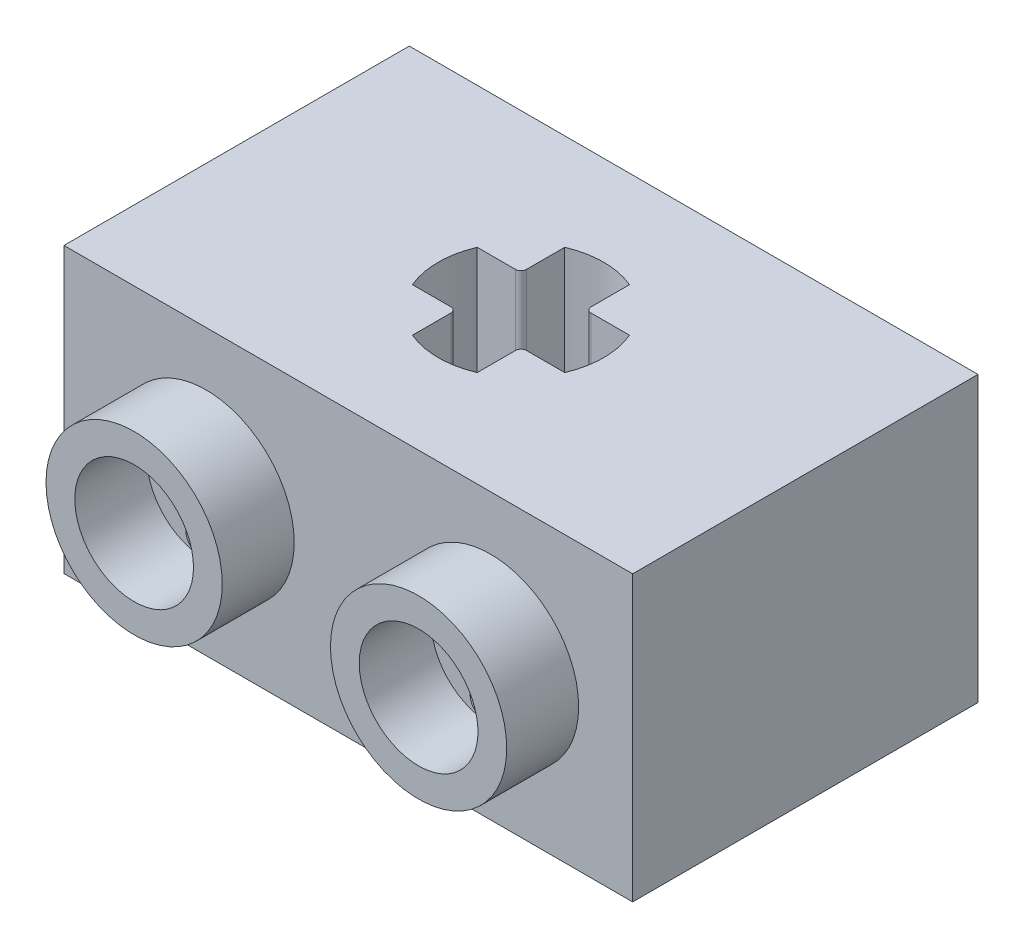
from build123d import *

# Parameters (mm, degrees)
SKETCH2_W                = 15.81
SKETCH2_H                = 7.9
BOSS_EXTRUDE3_DEPTH      = 9.6
SKETCH3_W                = 12.91
SKETCH3_H                = 5
CUT_EXTRUDE1_DEPTH       = 8.6
SKETCH5_R                = 2.535
BOSS_EXTRUDE4_DEPTH      = 7.9
CUT_EXTRUDE2_DEPTH       = 15.732923165
CUT_EXTRUDE2_DEPTH_BACK  = 15.732923165
BOSS_EXTRUDE5_REACH      = 15.048
BOSS_EXTRUDE5_END_RADIUS = 2.535
SKETCH9_R                = 2.449999362
SKETCH9_R_2              = 1.649999362
BOSS_EXTRUDE6_DEPTH      = 2
WRAP1_DEPTH              = 0.05


# Read off the part's stored shape, not the designer's step: Wrap1
with BuildPart() as part:
    # Sketch2 → Boss-Extrude3 (new body)
    with BuildSketch(Plane.XY):
        Rectangle(SKETCH2_W, SKETCH2_H)
    extrude(amount=BOSS_EXTRUDE3_DEPTH)

    # Sketch3 → Cut-Extrude1 (cut)
    with BuildSketch(Plane(origin=(0, 0, 0), x_dir=(-1, 0, 0), z_dir=(0, 0, -1))):
        Rectangle(SKETCH3_W, SKETCH3_H)
    extrude(amount=-CUT_EXTRUDE1_DEPTH, mode=Mode.SUBTRACT)

    # Sketch5 → Boss-Extrude4 (add)
    with BuildSketch(Plane.XZ.offset(3.95)):
        with Locations(Location((0, 4.8, 0), (0, 0, 270))):
            Circle(SKETCH5_R)
        with BuildLine():
            Line((-0.9, 6.916601049), (-0.9, 5.85))
            ThreePointArc((-0.9, 5.85), (-0.943933983, 5.743933983), (-1.05, 5.7))
            Line((-1.05, 5.7), (-2.116601049, 5.7))
            ThreePointArc((-2.116601049, 5.7), (-2.3, 4.8), (-2.116601049, 3.9))
            Line((-2.116601049, 3.9), (-1.05, 3.9))
            ThreePointArc((-1.05, 3.9), (-0.943933983, 3.856066017), (-0.9, 3.75))
            Line((-0.9, 3.75), (-0.9, 2.683398951))
            ThreePointArc((-0.9, 2.683398951), (0, 2.5), (0.9, 2.683398951))
            Line((0.9, 2.683398951), (0.9, 3.75))
            ThreePointArc((0.9, 3.75), (0.943933983, 3.856066017), (1.05, 3.9))
            Line((1.05, 3.9), (2.116601049, 3.9))
            ThreePointArc((2.116601049, 3.9), (2.3, 4.8), (2.116601049, 5.7))
            Line((2.116601049, 5.7), (1.05, 5.7))
            ThreePointArc((1.05, 5.7), (0.943933983, 5.743933983), (0.9, 5.85))
            Line((0.9, 5.85), (0.9, 6.916601049))
            ThreePointArc((0.9, 6.916601049), (0, 7.1), (-0.9, 6.916601049))
        make_face(mode=Mode.SUBTRACT)
    extrude(amount=-BOSS_EXTRUDE4_DEPTH)

    # Sketch5<3> → Cut-Extrude2 (cut, two sides: drawn at the far end of the back side and taken through both)
    with BuildSketch(Plane.XZ.offset(3.95).offset(-CUT_EXTRUDE2_DEPTH_BACK)):
        with BuildLine():
            ThreePointArc((0.9, 6.916601049), (0, 7.1), (-0.9, 6.916601049))
            Line((-0.9, 6.916601049), (-0.9, 5.85))
            ThreePointArc((-0.9, 5.85), (-0.943933983, 5.743933983), (-1.05, 5.7))
            Line((-1.05, 5.7), (-2.116601049, 5.7))
            ThreePointArc((-2.116601049, 5.7), (-2.3, 4.8), (-2.116601049, 3.9))
            Line((-2.116601049, 3.9), (-1.05, 3.9))
            ThreePointArc((-1.05, 3.9), (-0.943933983, 3.856066017), (-0.9, 3.75))
            Line((-0.9, 3.75), (-0.9, 2.683398951))
            ThreePointArc((-0.9, 2.683398951), (0, 2.5), (0.9, 2.683398951))
            Line((0.9, 2.683398951), (0.9, 3.75))
            ThreePointArc((0.9, 3.75), (0.943933983, 3.856066017), (1.05, 3.9))
            Line((1.05, 3.9), (2.116601049, 3.9))
            ThreePointArc((2.116601049, 3.9), (2.3, 4.8), (2.116601049, 5.7))
            Line((2.116601049, 5.7), (1.05, 5.7))
            ThreePointArc((1.05, 5.7), (0.943933983, 5.743933983), (0.9, 5.85))
            Line((0.9, 5.85), (0.9, 6.916601049))
        make_face()
    extrude(amount=CUT_EXTRUDE2_DEPTH + CUT_EXTRUDE2_DEPTH_BACK, mode=Mode.SUBTRACT)

    # Boss-Extrude5: up to this cylinder (the profile starts outside it)
    boss_extrude5_end = Plane(origin=(0, 0, 4.8), z_dir=(0, -1, 0)) * Cylinder(BOSS_EXTRUDE5_END_RADIUS, 40.222098, mode=Mode.PRIVATE)
    # Sketch8 → Boss-Extrude5 (add, up to the surface)
    with BuildSketch(Plane.XY, mode=Mode.PRIVATE) as boss_extrude5_sk1:
        with BuildLine():
            Line((1.142937221, 2.5), (1.142937221, 1.55))
            ThreePointArc((1.142937221, 1.55), (1.647670427, 1.525203497), (2.022937221, 1.863648927))
            Line((2.022937221, 1.863648927), (2.022937221, 2.5))
            Line((2.022937221, 2.5), (1.142937221, 2.5))
        make_face()
    boss_extrude5_tool1 = extrude(boss_extrude5_sk1.sketch, amount=BOSS_EXTRUDE5_REACH, mode=Mode.PRIVATE) - boss_extrude5_end
    add(boss_extrude5_tool1.solids().sort_by_distance((1.562277, 2.028049, 0))[0])
    # Sketch8 → Boss-Extrude5 (add, up to the surface)
    with BuildSketch(Plane.XY, mode=Mode.PRIVATE) as boss_extrude5_sk2:
        with BuildLine():
            Line((-2.022937221, 2.5), (-1.142937221, 2.5))
            Line((-1.142937221, 2.5), (-1.142937221, 1.55))
            ThreePointArc((-1.142937221, 1.55), (-1.647670427, 1.525203497), (-2.022937221, 1.863648927))
            Line((-2.022937221, 1.863648927), (-2.022937221, 2.5))
        make_face()
    boss_extrude5_tool2 = extrude(boss_extrude5_sk2.sketch, amount=BOSS_EXTRUDE5_REACH, mode=Mode.PRIVATE) - boss_extrude5_end
    add(boss_extrude5_tool2.solids().sort_by_distance((-1.562277, 2.028049, 0))[0])
    # Sketch8 → Boss-Extrude5 (add, up to the surface)
    with BuildSketch(Plane.XY, mode=Mode.PRIVATE) as boss_extrude5_sk3:
        with BuildLine():
            Line((-1.142937221, -2.5), (-1.142937221, -1.55))
            ThreePointArc((-1.142937221, -1.55), (-1.647670427, -1.525203497), (-2.022937221, -1.863648927))
            Line((-2.022937221, -1.863648927), (-2.022937221, -2.5))
            Line((-2.022937221, -2.5), (-1.142937221, -2.5))
        make_face()
    boss_extrude5_tool3 = extrude(boss_extrude5_sk3.sketch, amount=BOSS_EXTRUDE5_REACH, mode=Mode.PRIVATE) - boss_extrude5_end
    add(boss_extrude5_tool3.solids().sort_by_distance((-1.562277, -2.028049, 0))[0])
    # Sketch8 → Boss-Extrude5 (add, up to the surface)
    with BuildSketch(Plane.XY, mode=Mode.PRIVATE) as boss_extrude5_sk4:
        with BuildLine():
            Line((2.022937221, -2.5), (1.142937221, -2.5))
            Line((1.142937221, -2.5), (1.142937221, -1.55))
            ThreePointArc((1.142937221, -1.55), (1.647670427, -1.525203497), (2.022937221, -1.863648927))
            Line((2.022937221, -1.863648927), (2.022937221, -2.5))
        make_face()
    boss_extrude5_tool4 = extrude(boss_extrude5_sk4.sketch, amount=BOSS_EXTRUDE5_REACH, mode=Mode.PRIVATE) - boss_extrude5_end
    add(boss_extrude5_tool4.solids().sort_by_distance((1.562277, -2.028049, 0))[0])

    # Sketch9 → Boss-Extrude6 (add)
    # profile 1 of 2: a face of its own
    with BuildSketch(Plane.XY.offset(9.6)):
        with Locations(Location((-3.953750395, -0.001249605, 0), (0, 0, 180))):
            Circle(SKETCH9_R)
        with Locations((-3.953750395, -0.001249605)):
            Circle(SKETCH9_R_2, mode=Mode.SUBTRACT)
    # profile 2 of 2: a face of its own
    with BuildSketch(Plane.XY.offset(9.6)):
        with Locations(Location((3.953750395, -0.001249605, 0), (0, 0, 180))):
            Circle(SKETCH9_R)
        with Locations(Location((3.953750395, -0.001249605, 0), (0, 0, 180))):
            Circle(SKETCH9_R_2, mode=Mode.SUBTRACT)
    extrude(amount=BOSS_EXTRUDE6_DEPTH)

    # Wrap1 outline → Wrap1 (add)
    # profile 1 of 8: a face of its own
    with BuildSketch(Plane.XY.offset(9.6)):
        with BuildLine():
            add(Edge.make_bspline(
                [(3.539944984, -0.602676098), (3.532678796, -0.591193563), (3.517960093, -0.567934046), (3.498769062, -0.530618207), (3.481506482, -0.491077195), (3.466454355, -0.44962691), (3.454216198, -0.407208885), (3.445353936, -0.364589366), (3.439810331, -0.322331597), (3.439060411, -0.294213301), (3.438688974, -0.280286274)],
                knots=[0, 0, 0, 0, 0.119014041, 0.241079968, 0.367207712, 0.496859168, 0.627198146, 0.753675035, 0.877994942, 1, 1, 1, 1], degree=3))
            Line((3.539944984, -0.602676098), (3.874971026, -0.671343967))
            Line((3.874971026, -0.671343967), (3.874971026, -0.312541883))
            Line((3.874971026, -0.312541883), (3.779201795, -0.292257428))
            Line((3.779201795, -0.292257428), (3.779201795, -0.554292685))
            Line((3.779201795, -0.554292685), (3.604456202, -0.518545489))
            add(Edge.make_bspline(
                [(3.534458205, -0.277459752), (3.534715676, -0.286889065), (3.535236513, -0.305963615), (3.538469638, -0.334874887), (3.543989038, -0.364252278), (3.551749954, -0.394157355), (3.561506404, -0.424631227), (3.573865632, -0.455530706), (3.587792762, -0.487207488), (3.598833403, -0.507971004), (3.604456202, -0.518545489)],
                knots=[0, 0, 0, 0, 0.111547485, 0.225649323, 0.343691201, 0.464857784, 0.590915004, 0.721913245, 0.85837542, 1, 1, 1, 1], degree=3))
            add(Edge.make_bspline(
                [(3.782028317, -0.037039079), (3.772155195, -0.037220656), (3.752915608, -0.037574491), (3.725002549, -0.040597129), (3.698942449, -0.045492843), (3.674792036, -0.052544663), (3.652387419, -0.06139018), (3.632013715, -0.072684474), (3.613364315, -0.085682867), (3.596661536, -0.100703809), (3.582077699, -0.117563627), (3.569276584, -0.135876603), (3.558456486, -0.155724365), (3.549634668, -0.177136865), (3.542777876, -0.200086344), (3.538110294, -0.224548839), (3.534969436, -0.250499168), (3.534631793, -0.268305311), (3.534458205, -0.277459752)],
                knots=[0, 0, 0, 0, 0.07531528, 0.146765628, 0.21394358, 0.277375486, 0.338469483, 0.397328763, 0.454698705, 0.511591307, 0.568239783, 0.624431844, 0.681772167, 0.74035737, 0.800830599, 0.864191986, 0.930178786, 1, 1, 1, 1], degree=3))
            add(Edge.make_bspline(
                [(4.194201795, -0.387195329), (4.194107527, -0.379539752), (4.193919906, -0.364302864), (4.191376979, -0.341666268), (4.187882017, -0.319290714), (4.182417789, -0.297404219), (4.175901106, -0.275820356), (4.167358629, -0.25483745), (4.157866674, -0.233993501), (4.146501135, -0.213752245), (4.133742829, -0.194189534), (4.119586918, -0.175410681), (4.103710632, -0.157810433), (4.08636545, -0.14108628), (4.067423643, -0.125523371), (4.046941419, -0.110978431), (4.025058417, -0.097334592), (4.001614015, -0.084961905), (3.977157486, -0.073695106), (3.951746029, -0.063804688), (3.925461715, -0.055542138), (3.898386602, -0.048671358), (3.870424586, -0.043609368), (3.84175497, -0.039703454), (3.812154015, -0.037592688), (3.792173506, -0.037225513), (3.782028317, -0.037039079)],
                knots=[0, 0, 0, 0, 0.037928531, 0.075489126, 0.112795671, 0.150110308, 0.187215005, 0.224456754, 0.262314575, 0.300686267, 0.339395775, 0.378023303, 0.417128548, 0.456765771, 0.497358788, 0.538525081, 0.581216949, 0.62509282, 0.669839089, 0.714633405, 0.760162233, 0.806337966, 0.853001484, 0.900947803, 0.949705823, 1, 1, 1, 1], degree=3))
            add(Edge.make_bspline(
                [(4.023945385, -0.608329143), (4.030618543, -0.606697317), (4.043761715, -0.603483341), (4.062691931, -0.597284856), (4.080237629, -0.589421733), (4.096812145, -0.580947807), (4.112042292, -0.570793559), (4.12612199, -0.559614957), (4.138920788, -0.547081406), (4.150583653, -0.533509099), (4.160805425, -0.518670364), (4.169959562, -0.502968437), (4.177360909, -0.486074641), (4.183540469, -0.468227856), (4.188335868, -0.449369131), (4.191850569, -0.429537723), (4.193828173, -0.408684315), (4.194075492, -0.394459689), (4.194201795, -0.387195329)],
                knots=[0, 0, 0, 0, 0.06746451, 0.132875274, 0.19527459, 0.256145175, 0.315477603, 0.374730075, 0.432470568, 0.491157773, 0.550199845, 0.609209289, 0.669396999, 0.73102467, 0.794527735, 0.860304392, 0.928658985, 1, 1, 1, 1], degree=3))
            Line((4.023945385, -0.608329143), (4.03458641, -0.704098374))
            add(Edge.make_bspline(
                [(4.289971026, -0.389523053), (4.289611674, -0.403624023), (4.288907965, -0.431237634), (4.28269093, -0.471508212), (4.273054413, -0.509736243), (4.261250732, -0.539670885), (4.250206832, -0.562168582), (4.241077279, -0.577817821), (4.231769394, -0.592730177), (4.221283247, -0.606353797), (4.210440788, -0.619209944), (4.198640382, -0.630857693), (4.186436957, -0.641734476), (4.168733001, -0.654759925), (4.144297797, -0.669362983), (4.111343073, -0.683720474), (4.074493723, -0.695778258), (4.04823062, -0.701253747), (4.03458641, -0.704098374)],
                knots=[0, 0, 0, 0, 0.094575967, 0.185205985, 0.2727996, 0.358651345, 0.400567544, 0.440887387, 0.480196164, 0.51843101, 0.556150437, 0.592969775, 0.629602666, 0.665754712, 0.74032025, 0.820077659, 0.906526729, 1, 1, 1, 1], degree=3))
            add(Edge.make_bspline(
                [(3.782360849, 0.058730152), (3.794558856, 0.058534679), (3.818770133, 0.058146695), (3.85465606, 0.055163088), (3.8897029, 0.049873494), (3.923967339, 0.043059701), (3.957306146, 0.033795023), (3.989882574, 0.02267408), (4.021541829, 0.009335078), (4.05226486, -0.005729785), (4.08145812, -0.022445727), (4.108962432, -0.040226481), (4.134515791, -0.059026709), (4.158047339, -0.078999792), (4.179452593, -0.100151735), (4.199084273, -0.122153698), (4.216606971, -0.145336012), (4.232025328, -0.169660514), (4.245616697, -0.194747745), (4.257561277, -0.220475444), (4.267450714, -0.246977358), (4.275880476, -0.274076212), (4.282184026, -0.301996701), (4.286556001, -0.330559803), (4.289604261, -0.359806704), (4.289847802, -0.379539137), (4.289971026, -0.389523053)],
                knots=[0, 0, 0, 0, 0.048371301, 0.096010026, 0.142665654, 0.188873398, 0.234462818, 0.279780701, 0.325293766, 0.370607385, 0.415397749, 0.458620577, 0.500425354, 0.541119353, 0.580906413, 0.619674518, 0.657961784, 0.696007938, 0.733773729, 0.771045104, 0.80839675, 0.845869768, 0.883512564, 0.921779007, 0.960422932, 1, 1, 1, 1], degree=3))
            add(Edge.make_bspline(
                [(3.547094423, -0.015091964), (3.55484345, -0.009150109), (3.570407384, 0.002784115), (3.596073642, 0.017526957), (3.62303964, 0.030552329), (3.651864961, 0.040726777), (3.682124505, 0.048987547), (3.714144295, 0.054485296), (3.747693931, 0.058108219), (3.770656867, 0.058520179), (3.782360849, 0.058730152)],
                knots=[0, 0, 0, 0, 0.116378168, 0.23374574, 0.352343528, 0.473232311, 0.597855211, 0.726129114, 0.860410701, 1, 1, 1, 1], degree=3))
            add(Edge.make_bspline(
                [(3.438688974, -0.280286274), (3.438968405, -0.265914612), (3.439509794, -0.23806995), (3.444816062, -0.19771842), (3.453180395, -0.160153418), (3.464946336, -0.125285633), (3.480319615, -0.093290715), (3.499092315, -0.064163142), (3.52107458, -0.037602205), (3.538389394, -0.022622843), (3.547094423, -0.015091964)],
                knots=[0, 0, 0, 0, 0.145278943, 0.281473568, 0.41078632, 0.533976328, 0.652804696, 0.768789948, 0.88375906, 1, 1, 1, 1], degree=3))
        make_face()
    # profile 2 of 8: a face of its own
    with BuildSketch(Plane.XY.offset(9.6)):
        with BuildLine():
            add(Edge.make_bspline(
                [(4.289971026, -1.267241403), (4.289726718, -1.279673594), (4.289247064, -1.304081865), (4.284204253, -1.339744602), (4.276515642, -1.3736969), (4.265462911, -1.405857415), (4.251261564, -1.436200281), (4.234099548, -1.464918793), (4.213399196, -1.491541666), (4.19009978, -1.516468807), (4.164018466, -1.538895503), (4.13554192, -1.558425144), (4.105062745, -1.575139706), (4.072322191, -1.588669753), (4.03749017, -1.599091277), (4.000537636, -1.606530432), (3.961489108, -1.61110497), (3.934728746, -1.611637966), (3.921026715, -1.611910874)],
                knots=[0, 0, 0, 0, 0.065561895, 0.128718463, 0.189656453, 0.249031943, 0.307776767, 0.366157209, 0.425178009, 0.485383876, 0.545938906, 0.606292333, 0.667280128, 0.729032333, 0.792871126, 0.858829055, 0.927716649, 1, 1, 1, 1], degree=3))
            add(Edge.make_bspline(
                [(3.797491058, -0.835116002), (3.815407557, -0.835500423), (3.850451546, -0.836252335), (3.90176293, -0.842098623), (3.950432675, -0.852071204), (3.996527546, -0.865877737), (4.040078511, -0.883464176), (4.080782039, -0.905414848), (4.118973741, -0.931158124), (4.154138767, -0.960627298), (4.18583617, -0.992836437), (4.213729514, -1.026943117), (4.237316435, -1.062796375), (4.256530681, -1.100457134), (4.271634986, -1.139723541), (4.282275983, -1.180767205), (4.288720655, -1.223474999), (4.289550797, -1.252532228), (4.289971026, -1.267241403)],
                knots=[0, 0, 0, 0, 0.073386139, 0.143540482, 0.211222755, 0.276659402, 0.340408537, 0.403286895, 0.465755232, 0.528779351, 0.590912165, 0.650626303, 0.70900205, 0.766373054, 0.823507709, 0.881000335, 0.939760712, 1, 1, 1, 1], degree=3))
            add(Edge.make_bspline(
                [(3.438688974, -1.176958951), (3.43878188, -1.168860588), (3.438965551, -1.152850516), (3.441484656, -1.12915502), (3.445058, -1.105982871), (3.450195158, -1.083358722), (3.456948566, -1.061356848), (3.464837096, -1.03977085), (3.474629026, -1.018882633), (3.48542048, -0.998406546), (3.497973198, -0.979096579), (3.51140438, -0.96062921), (3.526229831, -0.943591614), (3.542098261, -0.927610966), (3.559277978, -0.913081768), (3.577418885, -0.899438354), (3.596941559, -0.887405664), (3.617391953, -0.876452954), (3.638556265, -0.866615512), (3.660361364, -0.858426197), (3.682374647, -0.851230902), (3.704695753, -0.845130087), (3.727441719, -0.840722468), (3.750537491, -0.837587142), (3.773898213, -0.835490282), (3.789616676, -0.835240922), (3.797491058, -0.835116002)],
                knots=[0, 0, 0, 0, 0.043743457, 0.086478703, 0.128627456, 0.170404265, 0.211713602, 0.25293708, 0.29448027, 0.336287127, 0.377910132, 0.418823457, 0.459592923, 0.49983088, 0.540405162, 0.581077705, 0.622380528, 0.664187385, 0.706399937, 0.748395181, 0.789973984, 0.831530128, 0.873350929, 0.915071874, 0.957454082, 1, 1, 1, 1], degree=3))
            add(Edge.make_bspline(
                [(3.479091619, -1.354032268), (3.475834527, -1.34709073), (3.46932742, -1.333222734), (3.46135706, -1.311752317), (3.454236453, -1.290110678), (3.448654566, -1.268090524), (3.444096417, -1.245800577), (3.440957979, -1.2231434), (3.439110344, -1.2001564), (3.438829974, -1.184721352), (3.438688974, -1.176958951)],
                knots=[0, 0, 0, 0, 0.125524858, 0.250777039, 0.374779807, 0.498503214, 0.622575723, 0.747217984, 0.872874041, 1, 1, 1, 1], degree=3))
            add(Edge.make_bspline(
                [(3.698063974, -1.56352746), (3.685591085, -1.557306525), (3.660989184, -1.545036166), (3.626420994, -1.523205233), (3.594474664, -1.499087666), (3.56516699, -1.472874971), (3.539031489, -1.444745704), (3.515692341, -1.415706357), (3.495379053, -1.385657886), (3.484488592, -1.364511673), (3.479091619, -1.354032268)],
                knots=[0, 0, 0, 0, 0.135343291, 0.266955161, 0.396502281, 0.523849941, 0.648418396, 0.769085728, 0.885566078, 1, 1, 1, 1], degree=3))
            add(Edge.make_bspline(
                [(3.921026715, -1.611910874), (3.911103174, -1.611721648), (3.891399641, -1.611345932), (3.862132343, -1.609240142), (3.833395773, -1.60533466), (3.805191474, -1.600061103), (3.777539178, -1.593250413), (3.750482821, -1.584837353), (3.723884503, -1.575167397), (3.706664834, -1.567404742), (3.698063974, -1.56352746)],
                knots=[0, 0, 0, 0, 0.129450941, 0.257029292, 0.382476162, 0.507528738, 0.63113749, 0.753699654, 0.876978195, 1, 1, 1, 1], degree=3))
        make_face()
        with BuildLine():
            add(Edge.make_bspline(
                [(3.534458205, -1.184274656), (3.534783323, -1.195109427), (3.535429743, -1.216651829), (3.541458793, -1.248465506), (3.550485975, -1.279606646), (3.563571359, -1.309664492), (3.579961923, -1.338409318), (3.599145335, -1.365868872), (3.621435851, -1.391631545), (3.646320782, -1.416089929), (3.674511294, -1.438160443), (3.705711676, -1.457903356), (3.739908704, -1.475179707), (3.776662582, -1.489753113), (3.814700827, -1.501446141), (3.853035484, -1.509716489), (3.890994916, -1.515213864), (3.916297437, -1.51583414), (3.928841218, -1.516141643)],
                knots=[0, 0, 0, 0, 0.056929802, 0.113191558, 0.169728243, 0.227177277, 0.28513283, 0.343517798, 0.403050568, 0.464064854, 0.526750923, 0.590956916, 0.657960909, 0.727947498, 0.798667741, 0.866990194, 0.934060092, 1, 1, 1, 1], degree=3))
            add(Edge.make_bspline(
                [(3.793168141, -0.930885233), (3.781447609, -0.931260399), (3.7584123, -0.931997744), (3.7246042, -0.938091565), (3.692208004, -0.947608393), (3.666575995, -0.959091503), (3.647190252, -0.970033231), (3.633427431, -0.979289152), (3.620438661, -0.989409701), (3.608262381, -1.000586458), (3.596983055, -1.012754861), (3.586432343, -1.025772745), (3.576768195, -1.039786101), (3.565210425, -1.059593718), (3.552762723, -1.085345505), (3.54235916, -1.117637485), (3.535711303, -1.150694688), (3.534877137, -1.173048308), (3.534458205, -1.184274656)],
                knots=[0, 0, 0, 0, 0.086719102, 0.170436061, 0.25352114, 0.336179565, 0.377709943, 0.418224504, 0.458855261, 0.499512943, 0.540449198, 0.581590586, 0.623476208, 0.666333386, 0.751311899, 0.834617569, 0.916942284, 1, 1, 1, 1], degree=3))
            add(Edge.make_bspline(
                [(4.194201795, -1.269070329), (4.193905221, -1.258075289), (4.193317707, -1.236294064), (4.187918785, -1.204193677), (4.179457996, -1.173008777), (4.167425841, -1.142849638), (4.151917924, -1.113730048), (4.13329264, -1.085497412), (4.110875956, -1.058493148), (4.085555137, -1.032571397), (4.05730306, -1.008723825), (4.026479616, -0.98774871), (3.993300117, -0.970101995), (3.957702748, -0.955787271), (3.919880489, -0.944429805), (3.879676336, -0.936543857), (3.837173607, -0.93186177), (3.808088778, -0.931216341), (3.793168141, -0.930885233)],
                knots=[0, 0, 0, 0, 0.056367129, 0.111663549, 0.16649901, 0.221883074, 0.277844317, 0.335488418, 0.395082478, 0.457610277, 0.521171557, 0.584416641, 0.648522467, 0.713569037, 0.7809433, 0.850810297, 0.923465067, 1, 1, 1, 1], degree=3))
            add(Edge.make_bspline(
                [(3.928841218, -1.516141643), (3.938716859, -1.515921232), (3.957971895, -1.515491487), (3.986107295, -1.512050092), (4.012755291, -1.506710478), (4.037806303, -1.498843046), (4.061337112, -1.488804895), (4.083314075, -1.476504279), (4.103736328, -1.461908728), (4.122451095, -1.445350384), (4.139212898, -1.427073919), (4.153814457, -1.407579308), (4.166541106, -1.387167418), (4.176601282, -1.365518626), (4.184494104, -1.342842619), (4.190145189, -1.319177994), (4.193514464, -1.294439755), (4.193970275, -1.277615751), (4.194201795, -1.269070329)],
                knots=[0, 0, 0, 0, 0.072790231, 0.141922799, 0.20867778, 0.272908844, 0.335147688, 0.396982817, 0.458211472, 0.519869482, 0.580890536, 0.640712271, 0.699230311, 0.757907918, 0.816318862, 0.875982692, 0.937007849, 1, 1, 1, 1], degree=3))
        make_face(mode=Mode.SUBTRACT)
    # profile 3 of 8: a face of its own
    with BuildSketch(Plane.XY.offset(9.6)):
        with BuildLine():
            add(Edge.make_bspline(
                [(-4.365055016, -0.601875336), (-4.372321204, -0.590392801), (-4.387039907, -0.567133284), (-4.406230938, -0.529817444), (-4.423493518, -0.490276433), (-4.438545645, -0.448826148), (-4.450783802, -0.406408123), (-4.459646064, -0.363788603), (-4.465189669, -0.321530835), (-4.465939589, -0.293412538), (-4.466311026, -0.279485512)],
                knots=[0, 0, 0, 0, 0.119014041, 0.241079968, 0.367207712, 0.496859168, 0.627198146, 0.753675035, 0.877994942, 1, 1, 1, 1], degree=3))
            Line((-4.365055016, -0.601875336), (-4.030028974, -0.670543204))
            Line((-4.030028974, -0.670543204), (-4.030028974, -0.311741121))
            Line((-4.030028974, -0.311741121), (-4.125798205, -0.291456666))
            Line((-4.125798205, -0.291456666), (-4.125798205, -0.553491922))
            Line((-4.125798205, -0.553491922), (-4.300543798, -0.517744727))
            add(Edge.make_bspline(
                [(-4.370541795, -0.276658989), (-4.370284324, -0.286088302), (-4.369763487, -0.305162852), (-4.366530362, -0.334074124), (-4.361010962, -0.363451516), (-4.353250046, -0.393356593), (-4.343493596, -0.423830465), (-4.331134368, -0.454729944), (-4.317207238, -0.486406726), (-4.306166597, -0.507170242), (-4.300543798, -0.517744727)],
                knots=[0, 0, 0, 0, 0.111547485, 0.225649323, 0.343691201, 0.464857784, 0.590915004, 0.721913245, 0.85837542, 1, 1, 1, 1], degree=3))
            add(Edge.make_bspline(
                [(-4.122971683, -0.036238316), (-4.132844805, -0.036419893), (-4.152084392, -0.036773728), (-4.179997451, -0.039796366), (-4.206057551, -0.04469208), (-4.230207964, -0.0517439), (-4.252612581, -0.060589418), (-4.272986285, -0.071883712), (-4.291635685, -0.084882104), (-4.308338464, -0.099903046), (-4.322922301, -0.116762864), (-4.335723416, -0.13507584), (-4.346543514, -0.154923603), (-4.355365332, -0.176336102), (-4.362222124, -0.199285581), (-4.366889706, -0.223748077), (-4.370030564, -0.249698405), (-4.370368207, -0.267504548), (-4.370541795, -0.276658989)],
                knots=[0, 0, 0, 0, 0.07531528, 0.146765628, 0.21394358, 0.277375486, 0.338469483, 0.397328763, 0.454698705, 0.511591307, 0.568239783, 0.624431844, 0.681772167, 0.74035737, 0.800830599, 0.864191986, 0.930178786, 1, 1, 1, 1], degree=3))
            add(Edge.make_bspline(
                [(-3.710798205, -0.386394566), (-3.710892473, -0.37873899), (-3.711080094, -0.363502101), (-3.713623021, -0.340865505), (-3.717117983, -0.318489952), (-3.722582211, -0.296603456), (-3.729098894, -0.275019593), (-3.737641371, -0.254036688), (-3.747133326, -0.233192739), (-3.758498865, -0.212951482), (-3.771257171, -0.193388771), (-3.785413082, -0.174609918), (-3.801289368, -0.157009671), (-3.81863455, -0.140285518), (-3.837576357, -0.124722608), (-3.858058581, -0.110177669), (-3.879941583, -0.096533829), (-3.903385985, -0.084161142), (-3.927842514, -0.072894343), (-3.953253971, -0.063003925), (-3.979538285, -0.054741375), (-4.006613398, -0.047870596), (-4.034575414, -0.042808605), (-4.06324503, -0.038902692), (-4.092845985, -0.036791926), (-4.112826494, -0.036424751), (-4.122971683, -0.036238316)],
                knots=[0, 0, 0, 0, 0.037928531, 0.075489126, 0.112795671, 0.150110308, 0.187215005, 0.224456754, 0.262314575, 0.300686267, 0.339395775, 0.378023303, 0.417128548, 0.456765771, 0.497358788, 0.538525081, 0.581216949, 0.62509282, 0.669839089, 0.714633405, 0.760162233, 0.806337966, 0.853001484, 0.900947803, 0.949705823, 1, 1, 1, 1], degree=3))
            add(Edge.make_bspline(
                [(-3.881054615, -0.60752838), (-3.874381457, -0.605896554), (-3.861238285, -0.602682578), (-3.842308069, -0.596484093), (-3.824762371, -0.588620971), (-3.808187855, -0.580147044), (-3.792957708, -0.569992796), (-3.77887801, -0.558814194), (-3.766079212, -0.546280643), (-3.754416347, -0.532708337), (-3.744194575, -0.517869601), (-3.735040438, -0.502167675), (-3.727639091, -0.485273879), (-3.721459531, -0.467427094), (-3.716664132, -0.448568369), (-3.713149431, -0.42873696), (-3.711171827, -0.407883552), (-3.710924508, -0.393658927), (-3.710798205, -0.386394566)],
                knots=[0, 0, 0, 0, 0.06746451, 0.132875274, 0.19527459, 0.256145175, 0.315477603, 0.374730075, 0.432470568, 0.491157773, 0.550199845, 0.609209289, 0.669396999, 0.73102467, 0.794527735, 0.860304392, 0.928658985, 1, 1, 1, 1], degree=3))
            Line((-3.881054615, -0.60752838), (-3.87041359, -0.703297611))
            add(Edge.make_bspline(
                [(-3.615028974, -0.388722291), (-3.615388326, -0.40282326), (-3.616092035, -0.430436871), (-3.62230907, -0.470707449), (-3.631945587, -0.508935481), (-3.643749268, -0.538870123), (-3.654793168, -0.561367819), (-3.663922721, -0.577017058), (-3.673230606, -0.591929414), (-3.683716753, -0.605553035), (-3.694559212, -0.618409181), (-3.706359618, -0.63005693), (-3.718563043, -0.640933714), (-3.736266999, -0.653959162), (-3.760702203, -0.668562221), (-3.793656927, -0.682919711), (-3.830506277, -0.694977495), (-3.85676938, -0.700452985), (-3.87041359, -0.703297611)],
                knots=[0, 0, 0, 0, 0.094575967, 0.185205985, 0.2727996, 0.358651345, 0.400567544, 0.440887387, 0.480196164, 0.51843101, 0.556150437, 0.592969775, 0.629602666, 0.665754712, 0.74032025, 0.820077659, 0.906526729, 1, 1, 1, 1], degree=3))
            add(Edge.make_bspline(
                [(-4.122639151, 0.059530914), (-4.110441144, 0.059335442), (-4.086229867, 0.058947457), (-4.05034394, 0.055963851), (-4.0152971, 0.050674257), (-3.981032661, 0.043860464), (-3.947693854, 0.034595785), (-3.915117426, 0.023474842), (-3.883458171, 0.010135841), (-3.85273514, -0.004929022), (-3.82354188, -0.021644965), (-3.796037568, -0.039425718), (-3.770484209, -0.058225947), (-3.746952661, -0.078199029), (-3.725547407, -0.099350973), (-3.705915727, -0.121352936), (-3.688393029, -0.14453525), (-3.672974672, -0.168859751), (-3.659383303, -0.193946982), (-3.647438723, -0.219674681), (-3.637549286, -0.246176596), (-3.629119524, -0.27327545), (-3.622815974, -0.301195939), (-3.618443999, -0.32975904), (-3.615395739, -0.359005942), (-3.615152198, -0.378738374), (-3.615028974, -0.388722291)],
                knots=[0, 0, 0, 0, 0.048371301, 0.096010026, 0.142665654, 0.188873398, 0.234462818, 0.279780701, 0.325293766, 0.370607385, 0.415397749, 0.458620577, 0.500425354, 0.541119353, 0.580906413, 0.619674518, 0.657961784, 0.696007938, 0.733773729, 0.771045104, 0.80839675, 0.845869768, 0.883512564, 0.921779007, 0.960422932, 1, 1, 1, 1], degree=3))
            add(Edge.make_bspline(
                [(-4.357905577, -0.014291201), (-4.35015655, -0.008349347), (-4.334592616, 0.003584877), (-4.308926358, 0.018327719), (-4.28196036, 0.031353091), (-4.253135039, 0.041527539), (-4.222875495, 0.04978831), (-4.190855705, 0.055286059), (-4.157306069, 0.058908981), (-4.134343133, 0.059320942), (-4.122639151, 0.059530914)],
                knots=[0, 0, 0, 0, 0.116378168, 0.23374574, 0.352343528, 0.473232311, 0.597855211, 0.726129114, 0.860410701, 1, 1, 1, 1], degree=3))
            add(Edge.make_bspline(
                [(-4.466311026, -0.279485512), (-4.466031595, -0.26511385), (-4.465490206, -0.237269188), (-4.460183938, -0.196917657), (-4.451819605, -0.159352655), (-4.440053664, -0.12448487), (-4.424680385, -0.092489952), (-4.405907685, -0.06336238), (-4.38392542, -0.036801443), (-4.366610606, -0.021822081), (-4.357905577, -0.014291201)],
                knots=[0, 0, 0, 0, 0.145278943, 0.281473568, 0.41078632, 0.533976328, 0.652804696, 0.768789948, 0.88375906, 1, 1, 1, 1], degree=3))
        make_face()
    # profile 4 of 8: a face of its own
    with BuildSketch(Plane.XY.offset(9.6)):
        with BuildLine():
            add(Edge.make_bspline(
                [(-3.615028974, -1.26644064), (-3.615273282, -1.278872831), (-3.615752936, -1.303281102), (-3.620795747, -1.338943839), (-3.628484358, -1.372896137), (-3.639537089, -1.405056652), (-3.653738436, -1.435399519), (-3.670900452, -1.464118031), (-3.691600804, -1.490740904), (-3.71490022, -1.515668045), (-3.740981534, -1.538094741), (-3.76945808, -1.557624381), (-3.799937255, -1.574338943), (-3.832677809, -1.58786899), (-3.86750983, -1.598290514), (-3.904462364, -1.605729669), (-3.943510892, -1.610304207), (-3.970271254, -1.610837203), (-3.983973285, -1.611110111)],
                knots=[0, 0, 0, 0, 0.065561895, 0.128718463, 0.189656453, 0.249031943, 0.307776767, 0.366157209, 0.425178009, 0.485383876, 0.545938906, 0.606292333, 0.667280128, 0.729032333, 0.792871126, 0.858829055, 0.927716649, 1, 1, 1, 1], degree=3))
            add(Edge.make_bspline(
                [(-4.107508942, -0.834315239), (-4.089592443, -0.83469966), (-4.054548454, -0.835451572), (-4.00323707, -0.84129786), (-3.954567325, -0.851270441), (-3.908472454, -0.865076974), (-3.864921489, -0.882663413), (-3.824217961, -0.904614086), (-3.786026259, -0.930357362), (-3.750861233, -0.959826535), (-3.71916383, -0.992035674), (-3.691270486, -1.026142355), (-3.667683565, -1.061995612), (-3.648469319, -1.099656371), (-3.633365014, -1.138922778), (-3.622724017, -1.179966442), (-3.616279345, -1.222674236), (-3.615449203, -1.251731466), (-3.615028974, -1.26644064)],
                knots=[0, 0, 0, 0, 0.073386139, 0.143540482, 0.211222755, 0.276659402, 0.340408537, 0.403286895, 0.465755232, 0.528779351, 0.590912165, 0.650626303, 0.70900205, 0.766373054, 0.823507709, 0.881000335, 0.939760712, 1, 1, 1, 1], degree=3))
            add(Edge.make_bspline(
                [(-4.466311026, -1.176158188), (-4.46621812, -1.168059826), (-4.466034449, -1.152049754), (-4.463515344, -1.128354257), (-4.459942, -1.105182108), (-4.454804842, -1.082557959), (-4.448051434, -1.060556085), (-4.440162904, -1.038970087), (-4.430370974, -1.01808187), (-4.41957952, -0.997605784), (-4.407026802, -0.978295816), (-4.39359562, -0.959828448), (-4.378770169, -0.942790851), (-4.362901739, -0.926810203), (-4.345722022, -0.912281006), (-4.327581115, -0.898637591), (-4.308058441, -0.886604901), (-4.287608047, -0.875652191), (-4.266443735, -0.86581475), (-4.244638636, -0.857625435), (-4.222625353, -0.850430139), (-4.200304247, -0.844329325), (-4.177558281, -0.839921706), (-4.154462509, -0.836786379), (-4.131101787, -0.83468952), (-4.115383324, -0.83444016), (-4.107508942, -0.834315239)],
                knots=[0, 0, 0, 0, 0.043743457, 0.086478703, 0.128627456, 0.170404265, 0.211713602, 0.25293708, 0.29448027, 0.336287127, 0.377910132, 0.418823457, 0.459592923, 0.49983088, 0.540405162, 0.581077705, 0.622380528, 0.664187385, 0.706399937, 0.748395181, 0.789973984, 0.831530128, 0.873350929, 0.915071874, 0.957454082, 1, 1, 1, 1], degree=3))
            add(Edge.make_bspline(
                [(-4.425908381, -1.353231505), (-4.429165473, -1.346289968), (-4.43567258, -1.332421971), (-4.44364294, -1.310951554), (-4.450763547, -1.289309915), (-4.456345434, -1.267289762), (-4.460903583, -1.244999814), (-4.464042021, -1.222342638), (-4.465889656, -1.199355637), (-4.466170026, -1.183920589), (-4.466311026, -1.176158188)],
                knots=[0, 0, 0, 0, 0.125524858, 0.250777039, 0.374779807, 0.498503214, 0.622575723, 0.747217984, 0.872874041, 1, 1, 1, 1], degree=3))
            add(Edge.make_bspline(
                [(-4.206936026, -1.562726698), (-4.219408915, -1.556505763), (-4.244010816, -1.544235404), (-4.278579006, -1.522404471), (-4.310525336, -1.498286904), (-4.33983301, -1.472074208), (-4.365968511, -1.443944941), (-4.389307659, -1.414905594), (-4.409620947, -1.384857123), (-4.420511408, -1.36371091), (-4.425908381, -1.353231505)],
                knots=[0, 0, 0, 0, 0.135343291, 0.266955161, 0.396502281, 0.523849941, 0.648418396, 0.769085728, 0.885566078, 1, 1, 1, 1], degree=3))
            add(Edge.make_bspline(
                [(-3.983973285, -1.611110111), (-3.993896826, -1.610920885), (-4.013600359, -1.61054517), (-4.042867657, -1.60843938), (-4.071604227, -1.604533897), (-4.099808526, -1.59926034), (-4.127460822, -1.59244965), (-4.154517179, -1.58403659), (-4.181115497, -1.574366634), (-4.198335166, -1.566603979), (-4.206936026, -1.562726698)],
                knots=[0, 0, 0, 0, 0.129450941, 0.257029292, 0.382476162, 0.507528738, 0.63113749, 0.753699654, 0.876978195, 1, 1, 1, 1], degree=3))
        make_face()
        with BuildLine():
            add(Edge.make_bspline(
                [(-4.370541795, -1.183473893), (-4.370216677, -1.194308665), (-4.369570257, -1.215851066), (-4.363541207, -1.247664744), (-4.354514025, -1.278805883), (-4.341428641, -1.308863729), (-4.325038077, -1.337608555), (-4.305854665, -1.365068109), (-4.283564149, -1.390830782), (-4.258679218, -1.415289167), (-4.230488706, -1.43735968), (-4.199288324, -1.457102593), (-4.165091296, -1.474378945), (-4.128337418, -1.48895235), (-4.090299173, -1.500645379), (-4.051964516, -1.508915726), (-4.014005084, -1.514413101), (-3.988702563, -1.515033377), (-3.976158782, -1.51534088)],
                knots=[0, 0, 0, 0, 0.056929802, 0.113191558, 0.169728243, 0.227177277, 0.28513283, 0.343517798, 0.403050568, 0.464064854, 0.526750923, 0.590956916, 0.657960909, 0.727947498, 0.798667741, 0.866990194, 0.934060092, 1, 1, 1, 1], degree=3))
            add(Edge.make_bspline(
                [(-4.111831859, -0.93008447), (-4.123552391, -0.930459637), (-4.1465877, -0.931196982), (-4.1803958, -0.937290802), (-4.212791996, -0.94680763), (-4.238424005, -0.958290741), (-4.257809748, -0.969232468), (-4.271572569, -0.978488389), (-4.284561339, -0.988608939), (-4.296737619, -0.999785695), (-4.308016945, -1.011954099), (-4.318567657, -1.024971982), (-4.328231805, -1.038985339), (-4.339789575, -1.058792956), (-4.352237277, -1.084544742), (-4.36264084, -1.116836723), (-4.369288697, -1.149893925), (-4.370122863, -1.172247546), (-4.370541795, -1.183473893)],
                knots=[0, 0, 0, 0, 0.086719102, 0.170436061, 0.25352114, 0.336179565, 0.377709943, 0.418224504, 0.458855261, 0.499512943, 0.540449198, 0.581590586, 0.623476208, 0.666333386, 0.751311899, 0.834617569, 0.916942284, 1, 1, 1, 1], degree=3))
            add(Edge.make_bspline(
                [(-3.710798205, -1.268269566), (-3.711094779, -1.257274527), (-3.711682293, -1.235493301), (-3.717081215, -1.203392914), (-3.725542004, -1.172208015), (-3.737574159, -1.142048875), (-3.753082076, -1.112929285), (-3.77170736, -1.084696649), (-3.794124044, -1.057692385), (-3.819444863, -1.031770634), (-3.84769694, -1.007923063), (-3.878520384, -0.986947947), (-3.911699883, -0.969301232), (-3.947297252, -0.954986508), (-3.985119511, -0.943629042), (-4.025323664, -0.935743095), (-4.067826393, -0.931061008), (-4.096911222, -0.930415578), (-4.111831859, -0.93008447)],
                knots=[0, 0, 0, 0, 0.056367129, 0.111663549, 0.16649901, 0.221883074, 0.277844317, 0.335488418, 0.395082478, 0.457610277, 0.521171557, 0.584416641, 0.648522467, 0.713569037, 0.7809433, 0.850810297, 0.923465067, 1, 1, 1, 1], degree=3))
            add(Edge.make_bspline(
                [(-3.976158782, -1.51534088), (-3.966283141, -1.51512047), (-3.947028105, -1.514690724), (-3.918892705, -1.51124933), (-3.892244709, -1.505909715), (-3.867193697, -1.498042284), (-3.843662888, -1.488004133), (-3.821685925, -1.475703517), (-3.801263672, -1.461107965), (-3.782548905, -1.444549621), (-3.765787102, -1.426273157), (-3.751185543, -1.406778545), (-3.738458894, -1.386366655), (-3.728398718, -1.364717864), (-3.720505896, -1.342041857), (-3.714854811, -1.318377231), (-3.711485536, -1.293638992), (-3.711029725, -1.276814988), (-3.710798205, -1.268269566)],
                knots=[0, 0, 0, 0, 0.072790231, 0.141922799, 0.20867778, 0.272908844, 0.335147688, 0.396982817, 0.458211472, 0.519869482, 0.580890536, 0.640712271, 0.699230311, 0.757907918, 0.816318862, 0.875982692, 0.937007849, 1, 1, 1, 1], degree=3))
        make_face(mode=Mode.SUBTRACT)
    # profile 5 of 8: a face of its own
    with BuildSketch(Plane.XY.offset(9.6)):
        Polygon((3.545099231, 1.399499383), (4.27933, 1.249028629), (4.27933, 1.346294254), (3.44933, 1.516550665), (3.44933, 0.984499383), (3.545099231, 0.963217331), align=None)
    # profile 6 of 8: a face of its own
    with BuildSketch(Plane.XY.offset(9.6)):
        Polygon((4.183560769, 0.137706514), (4.27933, 0.122576306), (4.27933, 0.707832716), (3.44933, 0.878089126), (3.44933, 0.25625419), (3.545099231, 0.236801065), (3.545099231, 0.761037844), (3.832406923, 0.702013405), (3.832406923, 0.228986562), (3.928176154, 0.207704511), (3.928176154, 0.68256028), (4.183560769, 0.630020216), align=None)
    # profile 7 of 8: a face of its own
    with BuildSketch(Plane.XY.offset(9.6)):
        Polygon((-4.359900769, 1.400300145), (-3.62567, 1.249829392), (-3.62567, 1.347095017), (-4.45567, 1.517351427), (-4.45567, 0.985300145), (-4.359900769, 0.964018094), align=None)
    # profile 8 of 8: a face of its own
    with BuildSketch(Plane.XY.offset(9.6)):
        Polygon((-3.721439231, 0.138507277), (-3.62567, 0.123377068), (-3.62567, 0.708633479), (-4.45567, 0.878889889), (-4.45567, 0.257054953), (-4.359900769, 0.237601828), (-4.359900769, 0.761838607), (-4.072593077, 0.702814168), (-4.072593077, 0.229787325), (-3.976823846, 0.208505273), (-3.976823846, 0.683361043), (-3.721439231, 0.630820979), align=None)
    extrude(amount=WRAP1_DEPTH)


solid = part.part
